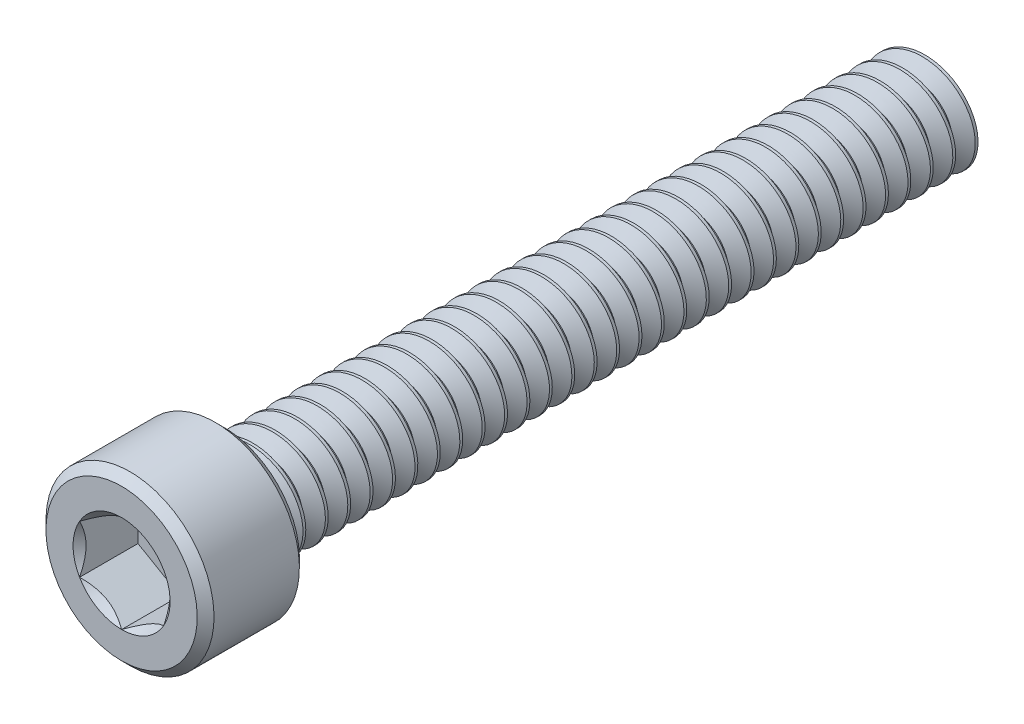
from build123d import *

# Parameters (mm, degrees)
CUT_EXTRUDE1_DEPTH = 2.757714286
CUT_SWEEP1_PITCH   = 1.058333333
CUT_SWEEP1_FROM    = 0
SKETCH8_R          = 5.934741422
CUT_EXTRUDE3_DEPTH = 4.5974


with BuildPart() as part:
    # Sketch2 → Revolve1 (revolve)
    with BuildSketch(Plane(origin=(0, 0, 0), x_dir=(0, 0, -1), z_dir=(1, 0, 0)), mode=Mode.PRIVATE) as revolve1_sk:
        Polygon((38.1, 2.1717), (37.8587, 2.413), (0, 2.413), (0, 3.571875), (-0.396875, 3.96875), (-4.429125, 3.96875), (-4.826, 3.571875), (-4.826, 1.984375), (-2.068285714, 1.984375), (-2.068285714, 0), (38.1, 0), align=None)
    revolve(revolve1_sk.sketch.rotate(Axis((0, 0, 2.068285714), (0, 0, -1)), 180), axis=Axis((0, 0, 2.068285714), (0, 0, -1)))

    # Sketch3 → Cut-Extrude1 (cut)
    with BuildSketch(Plane.XY.offset(4.826)):
        Polygon((0, 2.291358881), (-1.984375, 1.14567944), (-1.984375, -1.14567944), (0, -2.291358881), (1.984375, -1.14567944), (1.984375, 1.14567944), align=None)
    extrude(amount=-CUT_EXTRUDE1_DEPTH, mode=Mode.SUBTRACT)

    # Cut-Extrude2 cone 1 section (through the dimple's axis) → Cut-Extrude2 (revolve, cut)
    with BuildSketch(Plane(origin=(0, 0, 4.826), x_dir=(0, -1, 0), z_dir=(1, 0, 0))):
        Polygon((0, 0), (2.291358881, 0), (0, 2.291358881), align=None)
    revolve(axis=Axis((0, 0, 4.826), (0, 0, -1)), mode=Mode.SUBTRACT)


with BuildPart() as body_2:
    # Split1: read off the stored shape, not the designer's step
    # Split1: the piece on the far side of the plane
    add(part.part)
    split(bisect_by=Plane.XY, keep=Keep.BOTTOM)

    # Cut-Sweep1: arcs per turn and ends read off the stored shape
    # Cut-Sweep1: the profile of Sketch7 screwed along a right-hand helix through 38 turns, 8 arcs to a turn; built about Z, then put on its axis
    cut_sweep1_z = Axis((0, 0, 0), (0, 0, 1))
    cut_sweep1_corners = [(2.470283972, 0, -2.017447917), (2.527567944, 0, -0.9921875), (1.725592336, 0, -1.455208333), (1.725592336, 0, -1.5875)]
    with BuildLine(mode=Mode.PRIVATE) as cut_sweep1_profile:
        Line(cut_sweep1_corners[0], cut_sweep1_corners[1])
        Line(cut_sweep1_corners[1], cut_sweep1_corners[2])
        Line(cut_sweep1_corners[2], cut_sweep1_corners[3])
        Line(cut_sweep1_corners[3], cut_sweep1_corners[0])
    cut_sweep1_cap = Face(cut_sweep1_profile.wire())
    cut_sweep1_turn_angles = [0, 22.5, 45, 67.5, 90, 112.5, 135, 157.5, 180, 202.5, 225, 247.5, 270, 292.5, 315, 337.5, 360]
    cut_sweep1_turn_weights = [1, 0.9238795325112867, 1, 0.9238795325112867, 1, 0.9238795325112867, 1, 0.9238795325112867, 1, 0.9238795325112867, 1, 0.9238795325112867, 1, 0.9238795325112867, 1, 0.9238795325112867, 1]
    cut_sweep1_turn_rails = [Edge.make_bspline([Vector(p[0], p[1], 0).rotate(cut_sweep1_z, cut_sweep1_turn_angles[k]) / cut_sweep1_turn_weights[k] + Vector(0, 0, p[2] + CUT_SWEEP1_PITCH * cut_sweep1_turn_angles[k] / 360) for k in range(17)], [0, 0, 0, 1, 1, 2, 2, 3, 3, 4, 4, 5, 5, 6, 6, 7, 7, 8, 8, 8], 2, cut_sweep1_turn_weights) for p in cut_sweep1_corners]
    cut_sweep1_turn_sides = [Face.make_surface_from_curves(cut_sweep1_turn_rails[p[0]], cut_sweep1_turn_rails[p[1]]) for p in [(0, 1), (1, 2), (2, 3), (3, 0)]]
    cut_sweep1 = Plane(origin=(0, 0, 0), x_dir=(0, 1, 0), z_dir=(0, 0, -1)) * split(Solid(Shell([*[p.moved(Location((0, 0, CUT_SWEEP1_PITCH * i))) for i in range(38) for p in cut_sweep1_turn_sides], cut_sweep1_cap, cut_sweep1_cap.rotate(cut_sweep1_z, 13680).moved(Location((0, 0, CUT_SWEEP1_PITCH * 13680 / 360)))])), bisect_by=Plane.XY.offset(CUT_SWEEP1_FROM), keep=Keep.TOP, mode=Mode.PRIVATE)
    add(cut_sweep1, mode=Mode.SUBTRACT)


with BuildPart() as part_1:
    add(part.part)

    # Split1
    split(bisect_by=Plane.XY, keep=Keep.TOP)

    # Combine1: union body 2
    add(body_2.part)

    # Sketch8 → Cut-Extrude3 (cut)
    with BuildSketch(Plane(origin=(0, 0, -38.1), x_dir=(-1, 0, 0), z_dir=(0, 0, -1))):
        with Locations((-2.222813164, 2.550573818)):
            Circle(SKETCH8_R)
    extrude(amount=-CUT_EXTRUDE3_DEPTH, mode=Mode.SUBTRACT)


solid = part_1.part
